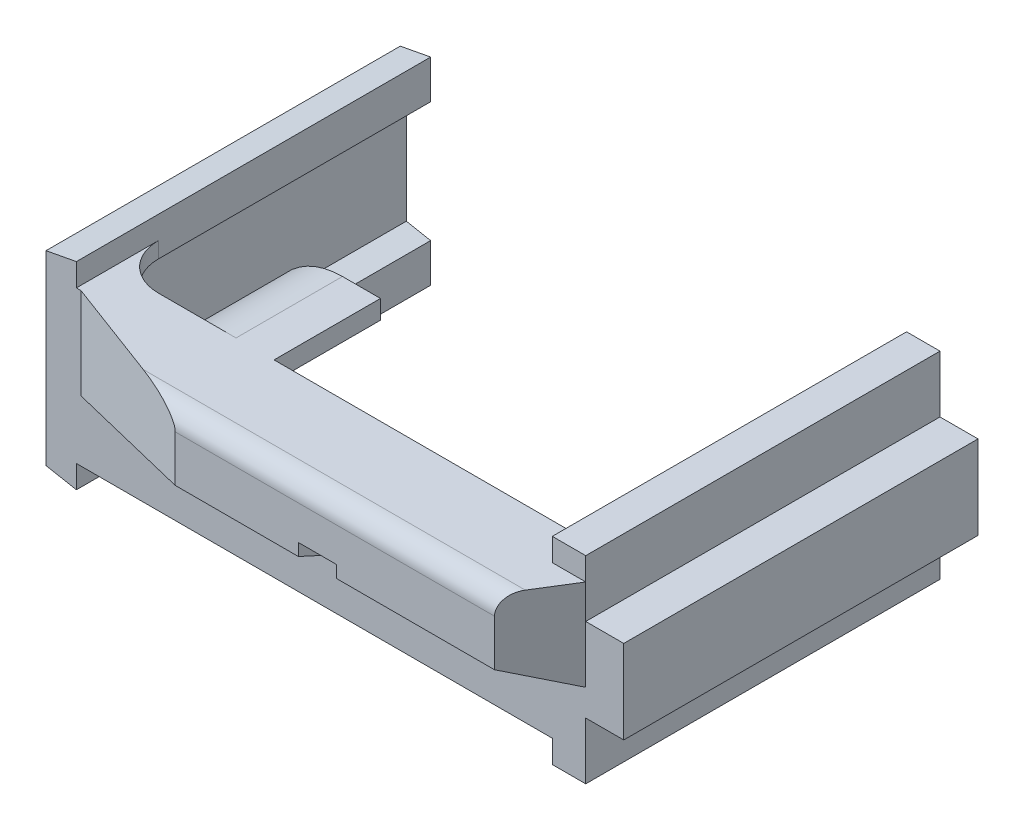
from build123d import *

# Parameters (mm, degrees)
BOSS_EXTRUDE1_DEPTH    = 34.29
SKETCH2_W              = 4.699
SKETCH2_H              = 1.905
CUT_EXTRUDE1_DEPTH     = 60.774381845
SKETCH3_W              = 3.175
SKETCH3_H              = 4.572
CUT_EXTRUDE2_DEPTH     = 9.779
CUT_EXTRUDE3_DEPTH     = 70.085665402
CUT_EXTRUDE4_START     = -26.543
CUT_EXTRUDE4_OUTLINE_W = 7.62
CUT_EXTRUDE4_OUTLINE_H = 4.7625
CUT_EXTRUDE4_DEPTH     = 26.543
FILLET4_R              = 1.5875


# Read off the part's stored shape, not the designer's step: Cut-Extrude4
with BuildPart() as part:
    # Sketch1 → Boss-Extrude1 (new body)
    with BuildSketch(Plane.XY):
        Polygon((9.398, 6.35), (9.398, -6.35), (9.398, -7.774459459), (11.938, -8.255), (11.938, -6.35), (51.689, -6.35), (51.689, -8.255), (54.483, -8.255), (54.483, -3.4925), (57.658, -3.4925), (57.658, 3.4925), (54.483, 3.4925), (54.483, 8.255), (51.689, 8.255), (51.689, 6.35), (11.938, 6.35), (11.938, 8.255), (9.398, 7.774459459), align=None)
    extrude(amount=-BOSS_EXTRUDE1_DEPTH)

    # Sketch2 → Cut-Extrude1 (cut, through all)
    with BuildSketch(Plane.ZY.offset(-9.398)):
        with Locations((-2.3495, 7.3025)):
            Rectangle(SKETCH2_W, SKETCH2_H)
        Polygon((-4.699, -8.255), (-4.699, -1.27), (0, 0.889), (0, -8.255), align=None)
    extrude(amount=-CUT_EXTRUDE1_DEPTH, mode=Mode.SUBTRACT)

    # Sketch3 → Cut-Extrude2 (cut)
    with BuildSketch(Plane.XY):
        with Locations((36.7665, -0.381)):
            Rectangle(SKETCH3_W, SKETCH3_H)
    extrude(amount=-CUT_EXTRUDE2_DEPTH, mode=Mode.SUBTRACT)

    # Sketch4 → Cut-Extrude3 (cut, through all)
    with BuildSketch(Plane.XZ.offset(8.255)):
        with BuildLine():
            Line((51.689, -34.29), (51.689, -7.747))
            Line((51.689, -7.747), (40.767, -7.747))
            Line((40.767, -7.747), (40.767, -10.668))
            ThreePointArc((40.767, -10.668), (40.320630735, -11.745630735), (39.243, -12.192))
            Line((39.243, -12.192), (34.671, -12.192))
            ThreePointArc((34.671, -12.192), (33.593369265, -11.745630735), (33.147, -10.668))
            Line((33.147, -10.668), (33.147, -7.747))
            Line((33.147, -7.747), (25.4, -7.747))
            Line((25.4, -7.747), (25.4, -16.637))
            Line((25.4, -16.637), (15.875, -16.637))
            Line((15.875, -16.637), (15.875, -7.747))
            Line((15.875, -7.747), (15.748, -7.747))
            ThreePointArc((15.748, -7.747), (13.053923164, -8.862923164), (11.938, -11.557))
            Line((11.938, -11.557), (11.938, -34.29))
            Line((11.938, -34.29), (51.689, -34.29))
        make_face()
        with BuildLine():
            Line((35.179, -7.747), (38.354, -7.747))
            Line((38.354, -7.747), (38.354, -9.525))
            ThreePointArc((38.354, -9.525), (38.130815367, -10.063815367), (37.592, -10.287))
            Line((37.592, -10.287), (35.941, -10.287))
            ThreePointArc((35.941, -10.287), (35.402184633, -10.063815367), (35.179, -9.525))
            Line((35.179, -9.525), (35.179, -7.747))
        make_face()
        Polygon((57.658, -4.699), (54.483, -4.699), (51.562, 0), (57.658, 0), align=None)
        Polygon((6.604, -4.699), (12.319, -4.699), (24.892, 0), (6.604, 0), align=None)
    extrude(amount=-CUT_EXTRUDE3_DEPTH, mode=Mode.SUBTRACT)

    # Cut-Extrude4 outline → Cut-Extrude4 (cut)
    with BuildSketch(Plane(origin=(0, 0, -34.29), x_dir=(-1, 0, 0), z_dir=(0, 0, -1)).offset(CUT_EXTRUDE4_START)):
        with BuildLine():
            Line((-22.225, -6.35), (-15.875, -6.35))
            Line((-15.875, -6.35), (-15.875, -5.021000706))
            Line((-15.875, -5.021000706), (-11.938, -5.021000706))
            Line((-11.938, -5.021000706), (-9.906, -4.636568273))
            Line((-9.906, -4.636568273), (-9.906, 4.636568273))
            Line((-9.906, 4.636568273), (-11.938, 5.021000706))
            Line((-11.938, 5.021000706), (-15.875, 5.021000706))
            Line((-15.875, 5.021000706), (-15.875, 6.35))
            Line((-15.875, 6.35), (-22.225, 6.35))
            ThreePointArc((-22.225, 6.35), (-15.875, 0), (-22.225, -6.35))
        make_face()
        with Locations((-36.957, -3.96875)):
            Rectangle(CUT_EXTRUDE4_OUTLINE_W, CUT_EXTRUDE4_OUTLINE_H)
        with BuildLine():
            Line((-25.4, 4.7752), (-25.4, -4.7752))
            Line((-25.4, -4.7752), (-22.225, -4.7752))
            ThreePointArc((-22.225, -4.7752), (-17.4498, 0), (-22.225, 4.7752))
            Line((-22.225, 4.7752), (-25.4, 4.7752))
        make_face()
        with Locations((-36.957, 3.96875)):
            Rectangle(CUT_EXTRUDE4_OUTLINE_W, CUT_EXTRUDE4_OUTLINE_H)
        Polygon((-54.181998462, -1.397), (-51.689, -5.715), (-51.689, 5.715), (-54.181998462, 1.397), (-55.753, 1.397), (-55.753, -1.397), align=None)
    extrude(amount=CUT_EXTRUDE4_DEPTH, mode=Mode.SUBTRACT)

    # Fillet4
    fillet4_edges = [part.edges().sort_by_distance(p)[0] for p in [
        (38.227, 6.35, 0),
    ]]
    fillet(fillet4_edges, radius=FILLET4_R)


solid = part.part
